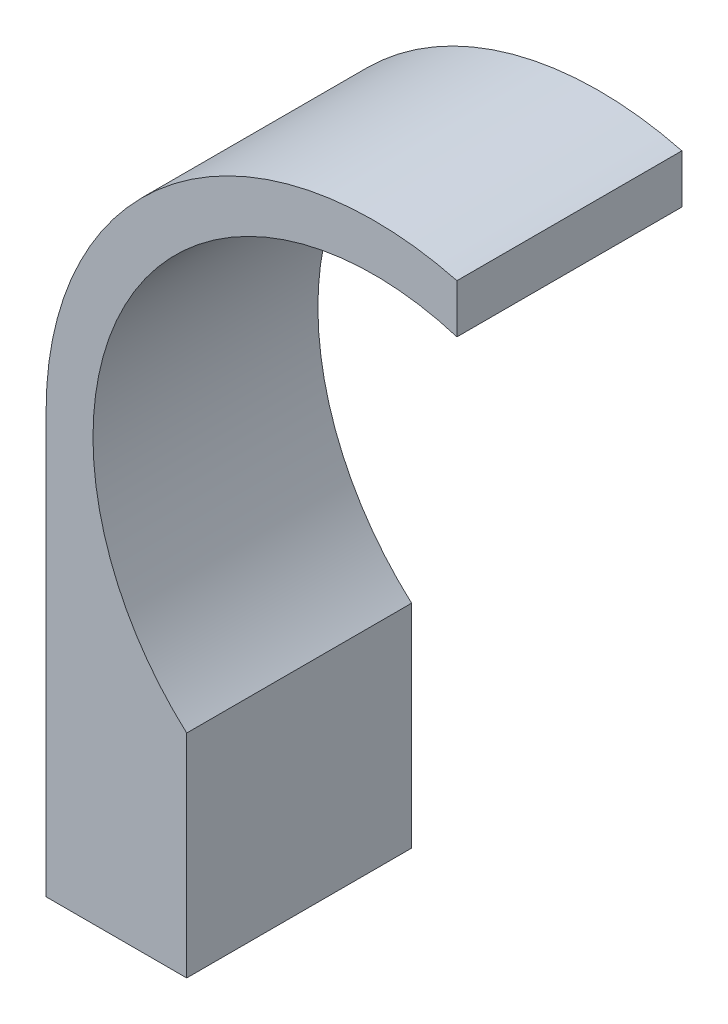
from build123d import *

# Parameters (mm, degrees)
INNER_RING_LEFT_SIDE_DEPTH = 120


with BuildPart() as part:
    # Sketch1 → Inner Ring - Left Side (new body)
    with BuildSketch(Plane.XY):
        with BuildLine():
            Line((-100, -111.803398875), (-100, -225))
            Line((-100, -225), (-175, -225))
            Line((-175, -225), (-175, 0))
            ThreePointArc((-175, 0), (-106.981306778, 138.491877018), (44.2, 169.326194075))
            Line((44.2, 169.326194075), (44.2, 143.340015348))
            ThreePointArc((44.2, 143.340015348), (-130.586945961, 73.804129591), (-100, -111.803398875))
        make_face()
    extrude(amount=INNER_RING_LEFT_SIDE_DEPTH)


solid = part.part
